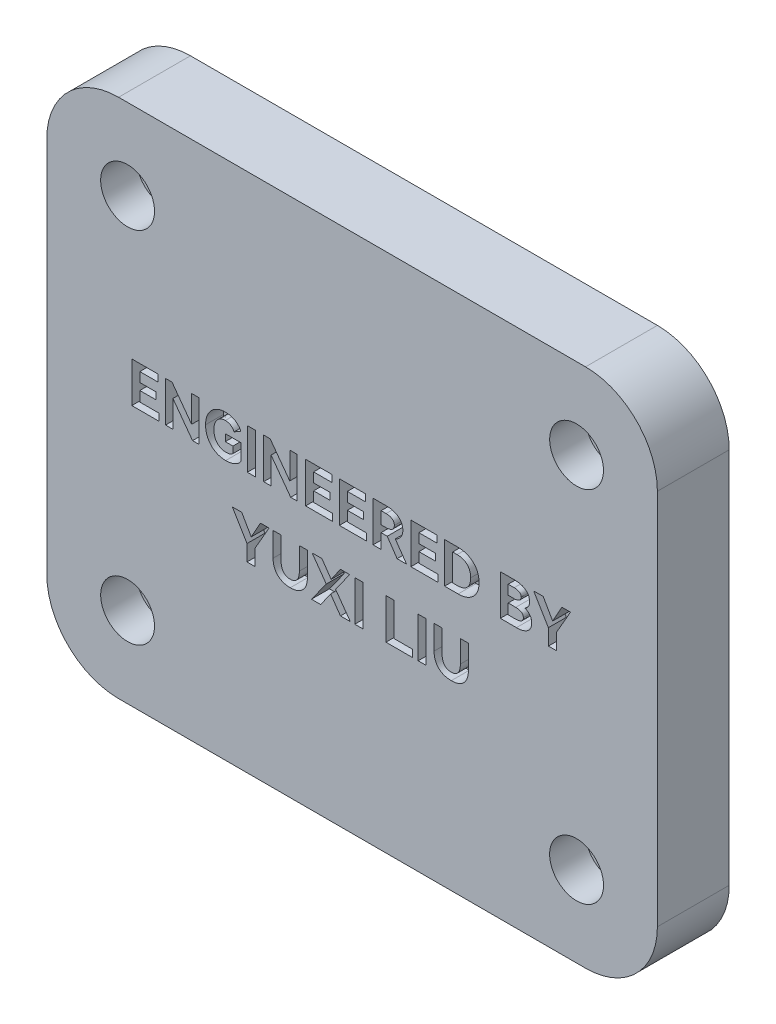
from build123d import *

# Parameters (mm, degrees)
SKETCH1_W           = 68
SKETCH1_H           = 58
BOSS_EXTRUDE1_DEPTH = 8
SKETCH2_R           = 1.6
CUT_EXTRUDE1_DEPTH  = 90.732937097
SKETCH3_R           = 3
CUT_EXTRUDE2_DEPTH  = 4
FILLET1_R           = 8
SKETCH4_W           = 0.89110672
SKETCH4_H           = 4.5
SKETCH4_W_2         = 0.891106719
CUT_EXTRUDE3_DEPTH  = 2


with BuildPart() as part:
    # Sketch1 → Boss-Extrude1 (new body)
    with BuildSketch(Plane.XY):
        with Locations((34, 29)):
            Rectangle(SKETCH1_W, SKETCH1_H)
    extrude(amount=BOSS_EXTRUDE1_DEPTH)

    # Sketch2 → Cut-Extrude1 (cut, through all)
    with BuildSketch(Plane.XY.offset(8)):
        with Locations((9, 49)):
            Circle(SKETCH2_R)
        with Locations((59, 49)):
            Circle(SKETCH2_R)
        with Locations((59, 9)):
            Circle(SKETCH2_R)
        with Locations((9, 9)):
            Circle(SKETCH2_R)
    extrude(amount=-CUT_EXTRUDE1_DEPTH, mode=Mode.SUBTRACT)

    # Sketch3 → Cut-Extrude2 (cut)
    with BuildSketch(Plane.XY.offset(8)):
        with Locations((9, 49)):
            Circle(SKETCH3_R)
        with Locations((59, 49)):
            Circle(SKETCH3_R)
        with Locations((59, 9)):
            Circle(SKETCH3_R)
        with Locations((9, 9)):
            Circle(SKETCH3_R)
    extrude(amount=-CUT_EXTRUDE2_DEPTH, mode=Mode.SUBTRACT)

    # Fillet1
    fillet1_edges = [part.edges().sort_by_distance(p)[0] for p in [
        (0, 0, 4),
        (68, 0, 4),
        (68, 58, 4),
        (0, 58, 4),
    ]]
    fillet(fillet1_edges, radius=FILLET1_R)

    # Sketch4 → Cut-Extrude3 (cut)
    # profile 1 of 19: a face of its own
    with BuildSketch(Plane.XY.offset(8)):
        Polygon((12.190019763, 30.899604743), (10.364229249, 30.899604743), (10.364229249, 29.78083004), (12.472826087, 29.78083004), (12.472826087, 29), (9.47312253, 29), (9.47312253, 33.5), (12.405237154, 33.5), (12.405237154, 32.725395257), (10.364229249, 32.725395257), (10.364229249, 31.66798419), (12.190019763, 31.66798419), align=None)
    # profile 2 of 19: a face of its own
    with BuildSketch(Plane.XY.offset(8)):
        Polygon((13.949110672, 33.5), (16.131521739, 30.5243083), (16.131521739, 33.5), (16.961264822, 33.5), (16.961264822, 29), (16.235573123, 29), (14.047826087, 31.981027668), (14.047826087, 29), (13.229644269, 29), (13.229644269, 33.5), align=None)
    # profile 3 of 19: a face of its own
    with BuildSketch(Plane.XY.offset(8)):
        with BuildLine():
            Line((19.88270751, 30.727075099), (19.88270751, 31.495454545))
            Line((19.88270751, 31.495454545), (21.603557312, 31.495454545))
            Line((21.603557312, 31.495454545), (21.603557312, 29.663438735))
            add(Edge.make_bspline(
                [(21.603557312, 29.663438735), (21.585447013, 29.635459828), (21.549129791, 29.579352739), (21.483778407, 29.501847101), (21.411893283, 29.428092613), (21.332367461, 29.358267831), (21.244525097, 29.293515303), (21.14966514, 29.231717851), (21.04577871, 29.176459685), (20.936457937, 29.123641364), (20.82075793, 29.078241641), (20.702085581, 29.036753427), (20.579431167, 29.003536577), (20.454429545, 28.974424008), (20.325956051, 28.953875328), (20.195233451, 28.93716636), (20.061277186, 28.92868716), (19.971056671, 28.927026331), (19.925395257, 28.926185771)],
                knots=[0, 0, 0, 0, 0.837760271, 1.679990217, 2.544929539, 3.427533874, 4.338910806, 5.288456801, 6.272945858, 7.297089327, 8.341320962, 9.397943387, 10.45827055, 11.53659533, 12.625366476, 13.72988631, 14.851075027, 16, 16, 16, 16], degree=3))
            add(Edge.make_bspline(
                [(19.925395257, 28.926185771), (19.871409128, 28.926938661), (19.764725815, 28.928426467), (19.607045736, 28.943308769), (19.453811488, 28.966301087), (19.305057423, 28.997880887), (19.161195377, 29.040336188), (19.021700147, 29.090670993), (18.886659717, 29.150475949), (18.757238472, 29.219742062), (18.633660795, 29.297431544), (18.515757924, 29.381345642), (18.406339853, 29.474800779), (18.303104708, 29.573882698), (18.207380985, 29.680793635), (18.117984879, 29.794316297), (18.03776203, 29.916844827), (17.962681677, 30.044628298), (17.895738896, 30.178677193), (17.83950323, 30.318868234), (17.789638289, 30.463067224), (17.751500793, 30.612632974), (17.719587191, 30.766527349), (17.697892321, 30.925492423), (17.684083877, 31.089378631), (17.682448163, 31.200169384), (17.681620553, 31.256225296)],
                knots=[0, 0, 0, 0, 1.069561296, 2.113586308, 3.135478133, 4.139054237, 5.124324395, 6.105523171, 7.075971085, 8.048372863, 9.011682409, 9.96706009, 10.913291369, 11.860525061, 12.800627657, 13.754830667, 14.721001889, 15.700334832, 16.690775213, 17.686757511, 18.691776819, 19.711978727, 20.743098853, 21.804839495, 22.889332181, 24, 24, 24, 24], degree=3))
            add(Edge.make_bspline(
                [(17.681620553, 31.256225296), (17.682338975, 31.312882599), (17.683755609, 31.424603387), (17.699035365, 31.589284548), (17.720455292, 31.749232262), (17.752842427, 31.903885675), (17.793450865, 32.054112689), (17.8446463, 32.198732073), (17.902836931, 32.339200919), (17.971957173, 32.473275494), (18.047737827, 32.60194538), (18.131602606, 32.722934999), (18.221747917, 32.83657806), (18.318951419, 32.942646704), (18.422918612, 33.041359504), (18.53383921, 33.132497567), (18.651142017, 33.216118138), (18.774939167, 33.291566893), (18.903742404, 33.359283907), (19.037031444, 33.417688096), (19.173607483, 33.467735011), (19.31340981, 33.509044483), (19.457164658, 33.539563432), (19.603705448, 33.563163425), (19.754094276, 33.57660903), (19.855409131, 33.578295896), (19.906719368, 33.579150198)],
                knots=[0, 0, 0, 0, 1.131159616, 2.230498763, 3.300513467, 4.352457935, 5.383673727, 6.405979992, 7.414253141, 8.417735126, 9.415806143, 10.394568984, 11.355223429, 12.310609564, 13.265408537, 14.21597661, 15.175353225, 16.139940019, 17.109148635, 18.079351229, 19.043919855, 20.012477316, 20.987904129, 21.976802477, 22.975365016, 24, 24, 24, 24], degree=3))
            add(Edge.make_bspline(
                [(19.906719368, 33.579150198), (19.957741945, 33.578353381), (20.058186994, 33.576784736), (20.206014044, 33.56269204), (20.349116485, 33.542108163), (20.486521983, 33.51059684), (20.619186239, 33.471550943), (20.74663359, 33.423253317), (20.869459761, 33.366830499), (20.985491776, 33.300373735), (21.095462155, 33.229405951), (21.196029117, 33.151779924), (21.287574526, 33.06966007), (21.369329282, 32.982214095), (21.443108414, 32.890611067), (21.505887802, 32.793010224), (21.561401855, 32.691536584), (21.589480018, 32.619905248), (21.603557312, 32.583992095)],
                knots=[0, 0, 0, 0, 1.17016001, 2.303622935, 3.403856837, 4.484454622, 5.534447873, 6.5739282, 7.608391433, 8.631549699, 9.638764269, 10.608576157, 11.542682489, 12.456771363, 13.352074797, 14.236699835, 15.115950192, 16, 16, 16, 16], degree=3))
            Line((21.603557312, 32.583992095), (20.866304348, 32.159782609))
            add(Edge.make_bspline(
                [(20.866304348, 32.159782609), (20.842751165, 32.205375626), (20.796433867, 32.295034225), (20.70430848, 32.414031084), (20.59980661, 32.519548247), (20.480179247, 32.608417335), (20.34792225, 32.680633245), (20.202752338, 32.730888687), (20.046600568, 32.763410013), (19.93831196, 32.766497585), (19.88270751, 32.768083004)],
                knots=[0, 0, 0, 0, 1.004386668, 1.97512485, 2.936911434, 3.908797535, 4.886714011, 5.879478124, 6.91114628, 8, 8, 8, 8], degree=3))
            add(Edge.make_bspline(
                [(19.88270751, 32.768083004), (19.82353494, 32.765969904), (19.707391906, 32.761822343), (19.538117607, 32.72580976), (19.378094463, 32.667702216), (19.228365362, 32.586329145), (19.090822965, 32.483953111), (18.968540785, 32.360016776), (18.861419855, 32.216746268), (18.77083859, 32.054408901), (18.698831788, 31.875119675), (18.647768576, 31.680944394), (18.615912822, 31.473082126), (18.612059983, 31.329861795), (18.610079051, 31.256225296)],
                knots=[0, 0, 0, 0, 0.961041044, 1.886316962, 2.799516737, 3.720263746, 4.646492936, 5.576775119, 6.540591128, 7.546013389, 8.590342615, 9.672792099, 10.803469879, 12, 12, 12, 12], degree=3))
            add(Edge.make_bspline(
                [(18.610079051, 31.256225296), (18.610572534, 31.217969109), (18.611545305, 31.142557056), (18.619810833, 31.031256469), (18.632806593, 30.923738881), (18.6519616, 30.820287498), (18.674386898, 30.720186329), (18.704260011, 30.624568211), (18.737628755, 30.532073415), (18.777997727, 30.444496325), (18.82209492, 30.360779922), (18.871405886, 30.282203188), (18.924582366, 30.208287375), (18.982466557, 30.13949658), (19.04521297, 30.076553016), (19.110919789, 30.016989469), (19.18259776, 29.963952998), (19.257935712, 29.915047998), (19.337111424, 29.871258564), (19.419873723, 29.834019936), (19.505860488, 29.802778081), (19.594747428, 29.777208556), (19.68670906, 29.75629344), (19.781899753, 29.742672087), (19.88014108, 29.733112154), (19.94671496, 29.732319602), (19.980533597, 29.731916996)],
                knots=[0, 0, 0, 0, 1.190036652, 2.345845502, 3.470321741, 4.557532515, 5.617930628, 6.659430926, 7.671944366, 8.674877908, 9.656813806, 10.613877645, 11.558417442, 12.487751382, 13.407286364, 14.321766241, 15.244025914, 16.177742668, 17.114733078, 18.055844735, 18.998220842, 19.958478747, 20.931801387, 21.929590883, 22.948259987, 24, 24, 24, 24], degree=3))
            add(Edge.make_bspline(
                [(19.980533597, 29.731916996), (20.019402652, 29.732790956), (20.095270605, 29.734496826), (20.205904828, 29.747189297), (20.310095806, 29.767344326), (20.40796079, 29.795711916), (20.498879894, 29.833070159), (20.583053032, 29.878926817), (20.661599178, 29.932094373), (20.707905717, 29.974688356), (20.731126482, 29.996047431)],
                knots=[0, 0, 0, 0, 1.142493035, 2.230015796, 3.269182953, 4.259205674, 5.220542896, 6.152556429, 7.073585425, 8, 8, 8, 8], degree=3))
            Line((20.731126482, 29.996047431), (20.731126482, 30.727075099))
            Line((20.731126482, 30.727075099), (19.88270751, 30.727075099))
        make_face()
    # profile 4 of 19: a face of its own
    with BuildSketch(Plane.XY.offset(8)):
        with Locations((22.781916996, 31.25)):
            Rectangle(SKETCH4_W, SKETCH4_H)
    # profile 5 of 19: a face of its own
    with BuildSketch(Plane.XY.offset(8)):
        Polygon((24.877173913, 33.5), (27.05958498, 30.5243083), (27.05958498, 33.5), (27.889328063, 33.5), (27.889328063, 29), (27.163636364, 29), (24.975889328, 31.981027668), (24.975889328, 29), (24.15770751, 29), (24.15770751, 33.5), align=None)
    # profile 6 of 19: a face of its own
    with BuildSketch(Plane.XY.offset(8)):
        Polygon((31.541798419, 30.899604743), (29.716007905, 30.899604743), (29.716007905, 29.78083004), (31.824604743, 29.78083004), (31.824604743, 29), (28.824901186, 29), (28.824901186, 33.5), (31.75701581, 33.5), (31.75701581, 32.725395257), (29.716007905, 32.725395257), (29.716007905, 31.66798419), (31.541798419, 31.66798419), align=None)
    # profile 7 of 19: a face of its own
    with BuildSketch(Plane.XY.offset(8)):
        Polygon((35.298320158, 30.899604743), (33.472529644, 30.899604743), (33.472529644, 29.78083004), (35.581126482, 29.78083004), (35.581126482, 29), (32.581422925, 29), (32.581422925, 33.5), (35.513537549, 33.5), (35.513537549, 32.725395257), (33.472529644, 32.725395257), (33.472529644, 31.66798419), (35.298320158, 31.66798419), align=None)
    # profile 8 of 19: a face of its own
    with BuildSketch(Plane.XY.offset(8)):
        with BuildLine():
            Line((40.075790514, 29), (39.01215415, 29.006225296))
            Line((39.01215415, 29.006225296), (37.918280632, 30.623023715))
            Line((37.918280632, 30.623023715), (37.880928854, 30.623023715))
            Line((37.880928854, 30.623023715), (37.229051383, 30.623023715))
            Line((37.229051383, 30.623023715), (37.229051383, 29))
            Line((37.229051383, 29), (36.337944664, 29))
            Line((36.337944664, 29), (36.337944664, 33.5))
            Line((36.337944664, 33.5), (37.893379447, 33.5))
            add(Edge.make_bspline(
                [(37.893379447, 33.5), (37.936679816, 33.499606859), (38.022189633, 33.498830482), (38.148223538, 33.489103588), (38.270605298, 33.476411814), (38.388844446, 33.456982396), (38.502579159, 33.430682165), (38.612748583, 33.400952622), (38.718540022, 33.364053528), (38.820654082, 33.322794195), (38.917544489, 33.275375392), (39.009289511, 33.224136509), (39.094941597, 33.167666163), (39.175456042, 33.107464879), (39.249551041, 33.041139713), (39.31768814, 32.970193591), (39.380687969, 32.894914748), (39.437214416, 32.815064858), (39.488192475, 32.731495571), (39.5318286, 32.644278992), (39.567841286, 32.553813054), (39.599877896, 32.461632198), (39.622436751, 32.365559348), (39.639601857, 32.267013963), (39.649360955, 32.165017603), (39.650833536, 32.096066959), (39.651581028, 32.061067194)],
                knots=[0, 0, 0, 0, 1.2200695, 2.409400225, 3.560858665, 4.687156797, 5.783684645, 6.849872993, 7.90145962, 8.939416468, 9.952046838, 10.939655477, 11.899012187, 12.841448216, 13.770493987, 14.69818634, 15.611737774, 16.534412784, 17.452879405, 18.368300956, 19.279020852, 20.195813937, 21.115799313, 22.056678637, 23.013558267, 24, 24, 24, 24], degree=3))
            add(Edge.make_bspline(
                [(39.651581028, 32.061067194), (39.65092733, 32.025760747), (39.649633377, 31.955873799), (39.638478491, 31.853110903), (39.621840227, 31.753469143), (39.597677141, 31.657149432), (39.566658974, 31.563717426), (39.528331327, 31.473570348), (39.482732353, 31.387251201), (39.430971496, 31.304370934), (39.373565843, 31.225129524), (39.308996587, 31.151336334), (39.239497974, 31.081783069), (39.164828487, 31.016713468), (39.084173188, 30.956779037), (38.99775389, 30.901963695), (38.906318748, 30.850729656), (38.84193412, 30.821759294), (38.809387352, 30.807114625)],
                knots=[0, 0, 0, 0, 1.054662233, 2.087639297, 3.085144338, 4.071218206, 5.051586526, 6.023918905, 6.994636113, 7.965474552, 8.941672438, 9.914932327, 10.892013905, 11.877769453, 12.871610298, 13.891324161, 14.934053283, 16, 16, 16, 16], degree=3))
            Line((38.809387352, 30.807114625), (40.075790514, 29))
        make_face()
        with BuildLine():
            Line((37.229051383, 32.743181818), (37.229051383, 31.378952569))
            Line((37.229051383, 31.378952569), (37.788438735, 31.378952569))
            add(Edge.make_bspline(
                [(37.788438735, 31.378952569), (37.820471735, 31.379448719), (37.883454677, 31.380424243), (37.975831558, 31.38856891), (38.064386311, 31.401784315), (38.148381445, 31.420521454), (38.228659971, 31.443329035), (38.303863977, 31.47305816), (38.375903199, 31.506754044), (38.443100893, 31.546411806), (38.50428215, 31.591565494), (38.558908306, 31.641318134), (38.603260091, 31.698489924), (38.641327413, 31.759785685), (38.6697824, 31.827704016), (38.690241884, 31.900559244), (38.701645259, 31.979191825), (38.703491999, 32.033166104), (38.70444664, 32.061067194)],
                knots=[0, 0, 0, 0, 1.193392064, 2.34643473, 3.452436324, 4.527106391, 5.551260628, 6.558417018, 7.536691432, 8.512280761, 9.460022067, 10.366574529, 11.254978474, 12.147219442, 13.047898509, 13.988597637, 14.960239605, 16, 16, 16, 16], degree=3))
            add(Edge.make_bspline(
                [(38.70444664, 32.061067194), (38.703456022, 32.089256557), (38.701528799, 32.144098255), (38.690564314, 32.223723151), (38.669376188, 32.297119875), (38.642492053, 32.365630905), (38.605126099, 32.427469757), (38.560631857, 32.484014282), (38.507287555, 32.534188856), (38.446613864, 32.578386105), (38.379925703, 32.617202837), (38.308514443, 32.651078974), (38.23265121, 32.679631423), (38.152208078, 32.702340284), (38.067747483, 32.721637801), (37.978402463, 32.733217295), (37.884950046, 32.741829667), (37.821069379, 32.742724654), (37.788438735, 32.743181818)],
                knots=[0, 0, 0, 0, 1.047934578, 2.038730344, 2.976872647, 3.881028202, 4.765166578, 5.651155837, 6.547222764, 7.476984859, 8.434839262, 9.410454722, 10.41093961, 11.4428885, 12.51463761, 13.626944928, 14.787828634, 16, 16, 16, 16], degree=3))
            Line((37.788438735, 32.743181818), (37.229051383, 32.743181818))
        make_face(mode=Mode.SUBTRACT)
    # profile 9 of 19: a face of its own
    with BuildSketch(Plane.XY.offset(8)):
        Polygon((43.266699605, 30.899604743), (41.440909091, 30.899604743), (41.440909091, 29.78083004), (43.549505929, 29.78083004), (43.549505929, 29), (40.549802372, 29), (40.549802372, 33.5), (43.481916996, 33.5), (43.481916996, 32.725395257), (41.440909091, 32.725395257), (41.440909091, 31.66798419), (43.266699605, 31.66798419), align=None)
    # profile 10 of 19: a face of its own
    with BuildSketch(Plane.XY.offset(8)):
        with BuildLine():
            add(Edge.make_bspline(
                [(45.806620553, 33.5), (45.860893251, 33.499100468), (45.96809906, 33.497323608), (46.126632921, 33.484576792), (46.281277371, 33.464039749), (46.432260393, 33.435960293), (46.579373829, 33.398700329), (46.721799539, 33.351740501), (46.8612025, 33.29882251), (46.995959883, 33.236487667), (47.125465595, 33.166848738), (47.247827345, 33.088751083), (47.363929083, 33.004465251), (47.472721689, 32.911664394), (47.574064805, 32.810907206), (47.668893169, 32.702994195), (47.755883775, 32.587091182), (47.836096765, 32.464272003), (47.908335844, 32.334673006), (47.970235608, 32.198163622), (48.024020375, 32.056355081), (48.067969231, 31.908133062), (48.100137771, 31.753295405), (48.123993555, 31.592960711), (48.140065557, 31.426709117), (48.141344392, 31.313773753), (48.141996047, 31.256225296)],
                knots=[0, 0, 0, 0, 1.071711807, 2.116971104, 3.138652708, 4.151338474, 5.148077585, 6.132969995, 7.111438821, 8.091097786, 9.062906638, 10.012978114, 10.955571233, 11.894065112, 12.833745052, 13.775465164, 14.728525936, 15.69302499, 16.670460021, 17.655439419, 18.650320097, 19.6635641, 20.704963763, 21.770502017, 22.863915051, 24, 24, 24, 24], degree=3))
            add(Edge.make_bspline(
                [(48.141996047, 31.256225296), (48.141334489, 31.198677443), (48.140032827, 31.085447948), (48.124036295, 30.918895329), (48.100257585, 30.758536558), (48.067740684, 30.603776154), (48.023819452, 30.455003553), (47.970670579, 30.312040924), (47.908069632, 30.174951138), (47.836142842, 30.044617006), (47.755868771, 29.920945516), (47.668952019, 29.804091082), (47.574046414, 29.695663902), (47.473668421, 29.593342292), (47.36485799, 29.500360014), (47.249582492, 29.414467486), (47.127361003, 29.336194754), (46.998937976, 29.265024408), (46.864511703, 29.203303456), (46.726000824, 29.148535975), (46.5831459, 29.102383249), (46.435724, 29.065174378), (46.284660146, 29.035584197), (46.128989052, 29.015463357), (45.969285126, 29.002686087), (45.861190355, 29.000901113), (45.806620553, 29)],
                knots=[0, 0, 0, 0, 1.133225957, 2.229702705, 3.292559499, 4.325627437, 5.341923461, 6.345235728, 7.327736395, 8.307822006, 9.2747903, 10.230122054, 11.173872514, 12.111187721, 13.051118595, 13.990105764, 14.940929524, 15.907968343, 16.879861028, 17.852542807, 18.840511852, 19.834742639, 20.845976449, 21.870875749, 22.925147923, 24, 24, 24, 24], degree=3))
            Line((45.806620553, 29), (44.306324111, 29))
            Line((44.306324111, 29), (44.306324111, 33.5))
            Line((44.306324111, 33.5), (45.806620553, 33.5))
        make_face()
        with BuildLine():
            add(Edge.make_bspline(
                [(45.701679842, 29.76215415), (45.760420111, 29.763362485), (45.874624063, 29.765711754), (46.040652842, 29.783495305), (46.196364301, 29.813523295), (46.341444644, 29.856005423), (46.476302954, 29.910488885), (46.600245529, 29.977075627), (46.713563238, 30.056259535), (46.816252272, 30.147002167), (46.906916809, 30.249930313), (46.986909915, 30.362550351), (47.053844891, 30.486247217), (47.107928476, 30.620673914), (47.150643454, 30.765074253), (47.180628524, 30.919917969), (47.198389562, 31.084761436), (47.20075994, 31.198077756), (47.201976285, 31.256225296)],
                knots=[0, 0, 0, 0, 1.167953641, 2.270757765, 3.315899487, 4.317593627, 5.272176862, 6.203262519, 7.109264452, 8.015438977, 8.921613502, 9.831003729, 10.756905575, 11.711488811, 12.707529366, 13.74688605, 14.843829069, 16, 16, 16, 16], degree=3))
            add(Edge.make_bspline(
                [(47.201976285, 31.256225296), (47.200735568, 31.31347902), (47.19831858, 31.425012623), (47.180873874, 31.58761985), (47.149485706, 31.740170436), (47.107105163, 31.882920051), (47.052715334, 32.016220849), (46.984963533, 32.138949538), (46.905260796, 32.252207949), (46.813223425, 32.354745729), (46.710101902, 32.446520483), (46.596076973, 32.525881041), (46.472851067, 32.594394935), (46.338083342, 32.64822063), (46.193350345, 32.690836407), (46.038381124, 32.722044788), (45.873130989, 32.739527856), (45.759823071, 32.741942671), (45.701679842, 32.743181818)],
                knots=[0, 0, 0, 0, 1.143434422, 2.227477164, 3.260895609, 4.249907975, 5.197672452, 6.130431302, 7.043765239, 7.957808935, 8.876271422, 9.79444762, 10.72720647, 11.685929401, 12.686289439, 13.737115077, 14.838815157, 16, 16, 16, 16], degree=3))
            Line((45.701679842, 32.743181818), (45.19743083, 32.743181818))
            Line((45.19743083, 32.743181818), (45.19743083, 29.76215415))
            Line((45.19743083, 29.76215415), (45.701679842, 29.76215415))
        make_face(mode=Mode.SUBTRACT)
    # profile 11 of 19: a face of its own
    with BuildSketch(Plane.XY.offset(8)):
        with BuildLine():
            add(Edge.make_bspline(
                [(53.258300395, 31.336264822), (53.288399813, 31.325098941), (53.347605217, 31.30313571), (53.43209886, 31.264024956), (53.510547507, 31.220111123), (53.583553647, 31.173195685), (53.65086755, 31.122501917), (53.711329619, 31.066886533), (53.766953273, 31.008012533), (53.817025839, 30.944859945), (53.860221694, 30.877243284), (53.898398597, 30.806030149), (53.929679335, 30.730735092), (53.957191634, 30.65169336), (53.977148891, 30.568524886), (53.991230642, 30.481405273), (54.000582482, 30.390520284), (54.001374197, 30.328383706), (54.001778656, 30.296640316)],
                knots=[0, 0, 0, 0, 1.118818822, 2.200711033, 3.241553326, 4.250512751, 5.223973887, 6.174905597, 7.110668516, 8.045118163, 8.979567809, 9.904137332, 10.858040273, 11.818803306, 12.818832771, 13.834753529, 14.893851807, 16, 16, 16, 16], degree=3))
            add(Edge.make_bspline(
                [(54.001778656, 30.296640316), (54.000397586, 30.247360541), (53.997697913, 30.151029913), (53.977023036, 30.010501281), (53.94239391, 29.877966501), (53.893516687, 29.753509044), (53.829526907, 29.637987619), (53.752553732, 29.530251875), (53.661274432, 29.431306882), (53.556384754, 29.341172977), (53.43936453, 29.260388024), (53.309842963, 29.191056646), (53.170189522, 29.131113273), (53.018592108, 29.083718022), (52.856469041, 29.045004524), (52.6826876, 29.019230724), (52.49794741, 29.002795035), (52.37108489, 29.000949365), (52.30583004, 29)],
                knots=[0, 0, 0, 0, 0.980494461, 1.916641186, 2.81961074, 3.70153889, 4.570265206, 5.44127233, 6.330648019, 7.24253577, 8.188428989, 9.154619336, 10.161697494, 11.208416174, 12.311731756, 13.475717384, 14.701573284, 16, 16, 16, 16], degree=3))
            Line((52.30583004, 29), (50.51027668, 29))
            Line((50.51027668, 29), (50.51027668, 33.5))
            Line((50.51027668, 33.5), (52.139525692, 33.5))
            add(Edge.make_bspline(
                [(52.139525692, 33.5), (52.198250047, 33.498931025), (52.312934691, 33.49684339), (52.480601938, 33.481877051), (52.639734519, 33.455647801), (52.791252095, 33.421150111), (52.933545336, 33.373204535), (53.068158533, 33.317504001), (53.194090724, 33.250434322), (53.31095859, 33.173552012), (53.417478958, 33.087832107), (53.509422685, 32.991728233), (53.588732067, 32.888518229), (53.652134805, 32.775643838), (53.702624545, 32.655264332), (53.736536012, 32.525876394), (53.758855843, 32.388816598), (53.761296921, 32.294460399), (53.762549407, 32.246047431)],
                knots=[0, 0, 0, 0, 1.221040176, 2.384607852, 3.496273299, 4.57277662, 5.611723703, 6.614569644, 7.599003706, 8.573487563, 9.51982331, 10.435302592, 11.332800376, 12.218922678, 13.119821967, 14.039421554, 14.994052076, 16, 16, 16, 16], degree=3))
            add(Edge.make_bspline(
                [(53.762549407, 32.246047431), (53.761016491, 32.19586178), (53.758042152, 32.098485841), (53.734899532, 31.957242874), (53.694927719, 31.826845481), (53.639040783, 31.706964626), (53.568218897, 31.596804882), (53.4803377, 31.498019348), (53.376761306, 31.409339025), (53.298447096, 31.361029853), (53.258300395, 31.336264822)],
                knots=[0, 0, 0, 0, 1.099553501, 2.133479419, 3.126079771, 4.079461809, 5.023768473, 5.985789349, 6.967442668, 8, 8, 8, 8], degree=3))
        make_face()
        with BuildLine():
            Line((51.383596838, 32.725395257), (51.383596838, 31.661758893))
            Line((51.383596838, 31.661758893), (52.05326087, 31.661758893))
            add(Edge.make_bspline(
                [(52.05326087, 31.661758893), (52.110576367, 31.663648766), (52.220001673, 31.667256863), (52.374997984, 31.693874067), (52.511204984, 31.741374927), (52.61003846, 31.796873001), (52.677732113, 31.849812968), (52.721346418, 31.892409516), (52.758540857, 31.93810428), (52.788059546, 31.987699977), (52.811124673, 32.040336609), (52.828320237, 32.095748577), (52.838160564, 32.154394908), (52.839586425, 32.194430193), (52.840316206, 32.214920949)],
                knots=[0, 0, 0, 0, 1.91479465, 3.655677756, 5.231467064, 6.713138413, 7.418562491, 8.097985844, 8.746148474, 9.381468873, 10.020100863, 10.662409344, 11.315397821, 12, 12, 12, 12], degree=3))
            add(Edge.make_bspline(
                [(52.840316206, 32.214920949), (52.839609676, 32.234827169), (52.838229947, 32.273700582), (52.828137787, 32.330118707), (52.812401669, 32.383271094), (52.788900912, 32.432504916), (52.758988481, 32.478251023), (52.72364713, 32.521467613), (52.680150261, 32.559553554), (52.613218464, 32.606964793), (52.51406512, 32.655569985), (52.377877906, 32.697085777), (52.221922913, 32.721615589), (52.111455725, 32.724091127), (52.05326087, 32.725395257)],
                knots=[0, 0, 0, 0, 0.680418715, 1.328740338, 1.954065901, 2.570786416, 3.186589749, 3.81999806, 4.473293787, 5.156801734, 6.621163746, 8.224356342, 10.010965592, 12, 12, 12, 12], degree=3))
            Line((52.05326087, 32.725395257), (51.383596838, 32.725395257))
        make_face(mode=Mode.SUBTRACT)
        with BuildLine():
            add(Edge.make_bspline(
                [(52.23201581, 29.774604743), (52.264928365, 29.775252147), (52.328736398, 29.776507278), (52.421430766, 29.782301046), (52.508255379, 29.793683363), (52.589138573, 29.811035525), (52.664594795, 29.830787898), (52.73408766, 29.855812537), (52.797333126, 29.886262023), (52.855385079, 29.920702506), (52.906994655, 29.959781305), (52.951969596, 30.002612145), (52.989810524, 30.049602247), (53.021150729, 30.099884416), (53.044340957, 30.155020272), (53.062444572, 30.212939456), (53.072030518, 30.275577334), (53.073469053, 30.318252124), (53.074209486, 30.340217391)],
                knots=[0, 0, 0, 0, 1.382825555, 2.680903359, 3.899677623, 5.05736951, 6.153970811, 7.174309096, 8.154648833, 9.098641606, 10.00525847, 10.868410623, 11.700830498, 12.533809106, 13.348147117, 14.206976277, 15.077107487, 16, 16, 16, 16], degree=3))
            add(Edge.make_bspline(
                [(53.074209486, 30.340217391), (53.073446074, 30.362178709), (53.071952719, 30.405138525), (53.062593861, 30.468119149), (53.044154117, 30.526528134), (53.021179092, 30.582299449), (52.989866376, 30.633517491), (52.951706236, 30.681347624), (52.907400484, 30.726070394), (52.855116871, 30.765779051), (52.797660517, 30.802311226), (52.733893575, 30.833741766), (52.663812876, 30.858958934), (52.588301263, 30.881628234), (52.506138088, 30.898275699), (52.417838419, 30.909438588), (52.323735015, 30.916665403), (52.259005778, 30.917732871), (52.225790514, 30.918280632)],
                knots=[0, 0, 0, 0, 0.912319421, 1.784641302, 2.63363131, 3.449950279, 4.283901569, 5.116397762, 5.986893518, 6.890617376, 7.836698498, 8.811187296, 9.835639131, 10.926367186, 12.082849546, 13.312068463, 14.620710532, 16, 16, 16, 16], degree=3))
            Line((52.225790514, 30.918280632), (51.383596838, 30.918280632))
            Line((51.383596838, 30.918280632), (51.383596838, 29.774604743))
            Line((51.383596838, 29.774604743), (52.23201581, 29.774604743))
        make_face(mode=Mode.SUBTRACT)
    # profile 12 of 19: a face of its own
    with BuildSketch(Plane.XY.offset(8)):
        Polygon((56.33715415, 31.655533597), (57.358102767, 33.5), (58.323023715, 33.5), (56.75513834, 30.770652174), (56.75513834, 29), (55.864031621, 29), (55.864031621, 30.77687747), (54.228557312, 33.5), (55.279743083, 33.5), align=None)
    # profile 13 of 19: a face of its own
    with BuildSketch(Plane.XY.offset(8)):
        Polygon((22.769565217, 22.983992095), (23.790513834, 24.828458498), (24.755434783, 24.828458498), (23.187549407, 22.099110672), (23.187549407, 20.328458498), (22.296442688, 20.328458498), (22.296442688, 22.105335968), (20.660968379, 24.828458498), (21.71215415, 24.828458498), align=None)
    # profile 14 of 19: a face of its own
    with BuildSketch(Plane.XY.offset(8)):
        with BuildLine():
            Line((28.129545455, 24.828458498), (29.020652174, 24.828458498))
            Line((29.020652174, 24.828458498), (29.020652174, 22.148023715))
            add(Edge.make_bspline(
                [(29.020652174, 22.148023715), (29.020000269, 22.100571553), (29.018719201, 22.007322545), (29.007661092, 21.869573501), (28.990171726, 21.736523943), (28.965361979, 21.60818027), (28.933047961, 21.484684296), (28.894257084, 21.365720187), (28.84780143, 21.251342371), (28.794293595, 21.142200912), (28.735427728, 21.037739754), (28.667685078, 20.940944845), (28.596051711, 20.8484879), (28.516493506, 20.76323032), (28.430920437, 20.683843042), (28.338945286, 20.61043368), (28.240151311, 20.544152361), (28.135680555, 20.483374929), (28.025923282, 20.429091369), (27.910245824, 20.383163177), (27.790300633, 20.342461799), (27.664545089, 20.311365623), (27.534452074, 20.284762215), (27.399178666, 20.267684969), (27.259081765, 20.256560754), (27.164054139, 20.255290484), (27.115711462, 20.254644269)],
                knots=[0, 0, 0, 0, 1.123185627, 2.207190164, 3.269163521, 4.298641387, 5.299496827, 6.289268694, 7.258831827, 8.21923409, 9.165403558, 10.093919452, 11.013481476, 11.932159396, 12.850837316, 13.77475387, 14.71486612, 15.664542481, 16.634334162, 17.610402549, 18.609041253, 19.630281915, 20.674885131, 21.750772402, 22.855767676, 24, 24, 24, 24], degree=3))
            add(Edge.make_bspline(
                [(27.115711462, 20.254644269), (27.066776428, 20.255293565), (26.970565598, 20.256570142), (26.828982325, 20.267633239), (26.69252681, 20.284759385), (26.561557796, 20.31139748), (26.435141186, 20.342279969), (26.314742914, 20.383385954), (26.198588907, 20.428860356), (26.08863855, 20.483403005), (25.984155546, 20.544146038), (25.885358271, 20.610431467), (25.793407808, 20.683857744), (25.707740085, 20.763173986), (25.628410676, 20.84883384), (25.555455755, 20.940315157), (25.48923796, 21.038344369), (25.428848381, 21.141865581), (25.375781379, 21.251420352), (25.328882596, 21.365526602), (25.291540871, 21.484873382), (25.258861968, 21.608152362), (25.234160224, 21.736531768), (25.216640679, 21.869571341), (25.205590815, 22.007323113), (25.20430861, 22.100571745), (25.203656126, 22.148023715)],
                knots=[0, 0, 0, 0, 1.155523229, 2.271866189, 3.352149668, 4.401149285, 5.42675874, 6.423034746, 7.403290734, 8.370787966, 9.31821747, 10.25610549, 11.177836133, 12.094340535, 13.010844938, 13.93257558, 14.854944135, 15.802373639, 16.760503668, 17.727772893, 18.713041353, 19.711528851, 20.738571055, 21.798031869, 22.879471739, 24, 24, 24, 24], degree=3))
            Line((25.203656126, 22.148023715), (25.203656126, 24.828458498))
            Line((25.203656126, 24.828458498), (26.094762846, 24.828458498))
            Line((26.094762846, 24.828458498), (26.094762846, 22.363241107))
            add(Edge.make_bspline(
                [(26.094762846, 22.363241107), (26.095627842, 22.310744537), (26.097306634, 22.208858813), (26.109880877, 22.061240363), (26.129891273, 21.923551267), (26.158793221, 21.796053742), (26.197390277, 21.679376991), (26.242188553, 21.572430393), (26.296911103, 21.47634396), (26.360101482, 21.39083301), (26.430925955, 21.315354681), (26.508756527, 21.250313907), (26.592766669, 21.194243542), (26.684703366, 21.150064616), (26.782518148, 21.114099882), (26.887591898, 21.089260804), (26.999421901, 21.075272488), (27.076245182, 21.073068837), (27.115711462, 21.071936759)],
                knots=[0, 0, 0, 0, 1.344225643, 2.608882906, 3.79093548, 4.905046283, 5.951733108, 6.93458622, 7.869601029, 8.776042514, 9.651434434, 10.513592479, 11.368433444, 12.230791999, 13.119350411, 14.032632583, 14.989308017, 16, 16, 16, 16], degree=3))
            add(Edge.make_bspline(
                [(27.115711462, 21.071936759), (27.154585464, 21.073076486), (27.230522432, 21.075302844), (27.341162338, 21.089287627), (27.44512634, 21.11393034), (27.54165036, 21.150235517), (27.632574889, 21.19450825), (27.716402201, 21.250003135), (27.793402473, 21.315682799), (27.864244806, 21.390787379), (27.927386526, 21.476356779), (27.982122803, 21.572426723), (28.026917129, 21.679378066), (28.065515342, 21.796053426), (28.09441695, 21.923551359), (28.114427446, 22.061240336), (28.12700166, 22.208858821), (28.128680456, 22.31074454), (28.129545455, 22.363241107)],
                knots=[0, 0, 0, 0, 0.99908038, 1.951616292, 2.860752761, 3.738180462, 4.596784729, 5.45467889, 6.31409399, 7.192612506, 8.102291486, 9.040645843, 10.027009366, 11.077434593, 12.195524613, 13.381799069, 14.650973249, 16, 16, 16, 16], degree=3))
            Line((28.129545455, 22.363241107), (28.129545455, 24.828458498))
        make_face()
    # profile 15 of 19: a face of its own
    with BuildSketch(Plane.XY.offset(8)):
        Polygon((33.737648221, 24.828458498), (32.157312253, 22.633596838), (33.811462451, 20.328458498), (32.704249012, 20.328458498), (31.610375494, 21.907905138), (30.51027668, 20.328458498), (29.477766798, 20.328458498), (31.124802372, 22.614920949), (29.551581028, 24.828458498), (30.639229249, 24.828458498), (31.67173913, 23.340612648), (32.704249012, 24.828458498), align=None)
    # profile 16 of 19: a face of its own
    with BuildSketch(Plane.XY.offset(8)):
        with Locations((34.747924901, 22.578458498)):
            Rectangle(SKETCH4_W_2, SKETCH4_H)
    # profile 17 of 19: a face of its own
    with BuildSketch(Plane.XY.offset(8)):
        Polygon((37.7743083, 24.828458498), (38.66541502, 24.828458498), (38.66541502, 21.127964427), (40.712648221, 21.127964427), (40.712648221, 20.328458498), (37.7743083, 20.328458498), align=None)
    # profile 18 of 19: a face of its own
    with BuildSketch(Plane.XY.offset(8)):
        with Locations((41.805632411, 22.578458498)):
            Rectangle(SKETCH4_W, SKETCH4_H)
    # profile 19 of 19: a face of its own
    with BuildSketch(Plane.XY.offset(8)):
        with BuildLine():
            Line((46.058399209, 24.828458498), (46.949505929, 24.828458498))
            Line((46.949505929, 24.828458498), (46.949505929, 22.148023715))
            add(Edge.make_bspline(
                [(46.949505929, 22.148023715), (46.948854024, 22.100571553), (46.947572956, 22.007322545), (46.936514847, 21.869573501), (46.919025481, 21.736523943), (46.894215734, 21.60818027), (46.861901716, 21.484684296), (46.823110839, 21.365720187), (46.776655185, 21.251342371), (46.72314735, 21.142200912), (46.664281483, 21.037739754), (46.596538833, 20.940944845), (46.524905466, 20.8484879), (46.44534726, 20.76323032), (46.359774192, 20.683843042), (46.267799041, 20.61043368), (46.169005066, 20.544152361), (46.06453431, 20.483374929), (45.954777036, 20.429091369), (45.839099579, 20.383163177), (45.719154388, 20.342461799), (45.593398844, 20.311365623), (45.463305829, 20.284762215), (45.328032421, 20.267684969), (45.18793552, 20.256560754), (45.092907894, 20.255290484), (45.044565217, 20.254644269)],
                knots=[0, 0, 0, 0, 1.123185627, 2.207190164, 3.269163521, 4.298641387, 5.299496827, 6.289268694, 7.258831827, 8.21923409, 9.165403558, 10.093919452, 11.013481476, 11.932159396, 12.850837316, 13.77475387, 14.71486612, 15.664542481, 16.634334162, 17.610402549, 18.609041253, 19.630281915, 20.674885131, 21.750772402, 22.855767676, 24, 24, 24, 24], degree=3))
            add(Edge.make_bspline(
                [(45.044565217, 20.254644269), (44.995630183, 20.255293565), (44.899419353, 20.256570142), (44.75783608, 20.267633239), (44.621380565, 20.284759385), (44.49041155, 20.31139748), (44.363994941, 20.342279969), (44.243596669, 20.383385954), (44.127442662, 20.428860356), (44.017492305, 20.483403005), (43.913009301, 20.544146038), (43.814212026, 20.610431467), (43.722261563, 20.683857744), (43.63659384, 20.763173986), (43.557264431, 20.84883384), (43.484309509, 20.940315157), (43.418091715, 21.038344369), (43.357702136, 21.141865581), (43.304635134, 21.251420352), (43.257736351, 21.365526602), (43.220394626, 21.484873382), (43.187715723, 21.608152362), (43.163013979, 21.736531768), (43.145494434, 21.869571341), (43.13444457, 22.007323113), (43.133162365, 22.100571745), (43.132509881, 22.148023715)],
                knots=[0, 0, 0, 0, 1.155523229, 2.271866189, 3.352149668, 4.401149285, 5.42675874, 6.423034746, 7.403290734, 8.370787966, 9.31821747, 10.25610549, 11.177836133, 12.094340535, 13.010844938, 13.93257558, 14.854944135, 15.802373639, 16.760503668, 17.727772893, 18.713041353, 19.711528851, 20.738571055, 21.798031869, 22.879471739, 24, 24, 24, 24], degree=3))
            Line((43.132509881, 22.148023715), (43.132509881, 24.828458498))
            Line((43.132509881, 24.828458498), (44.023616601, 24.828458498))
            Line((44.023616601, 24.828458498), (44.023616601, 22.363241107))
            add(Edge.make_bspline(
                [(44.023616601, 22.363241107), (44.024481597, 22.310744537), (44.026160389, 22.208858813), (44.038734632, 22.061240363), (44.058745028, 21.923551267), (44.087646976, 21.796053742), (44.126244032, 21.679376991), (44.171042308, 21.572430393), (44.225764858, 21.47634396), (44.288955237, 21.39083301), (44.35977971, 21.315354681), (44.437610282, 21.250313907), (44.521620424, 21.194243542), (44.613557121, 21.150064616), (44.711371903, 21.114099882), (44.816445653, 21.089260804), (44.928275656, 21.075272488), (45.005098937, 21.073068837), (45.044565217, 21.071936759)],
                knots=[0, 0, 0, 0, 1.344225643, 2.608882906, 3.79093548, 4.905046283, 5.951733108, 6.93458622, 7.869601029, 8.776042514, 9.651434434, 10.513592479, 11.368433444, 12.230791999, 13.119350411, 14.032632583, 14.989308017, 16, 16, 16, 16], degree=3))
            add(Edge.make_bspline(
                [(45.044565217, 21.071936759), (45.083439219, 21.073076486), (45.159376187, 21.075302844), (45.270016093, 21.089287627), (45.373980095, 21.11393034), (45.470504115, 21.150235517), (45.561428644, 21.19450825), (45.645255956, 21.250003135), (45.722256228, 21.315682799), (45.793098561, 21.390787379), (45.856240281, 21.476356779), (45.910976558, 21.572426723), (45.955770884, 21.679378066), (45.994369097, 21.796053426), (46.023270705, 21.923551359), (46.043281201, 22.061240336), (46.055855415, 22.208858821), (46.057534211, 22.31074454), (46.058399209, 22.363241107)],
                knots=[0, 0, 0, 0, 0.99908038, 1.951616292, 2.860752761, 3.738180462, 4.596784729, 5.45467889, 6.31409399, 7.192612506, 8.102291486, 9.040645843, 10.027009366, 11.077434593, 12.195524613, 13.381799069, 14.650973249, 16, 16, 16, 16], degree=3))
            Line((46.058399209, 22.363241107), (46.058399209, 24.828458498))
        make_face()
    extrude(amount=-CUT_EXTRUDE3_DEPTH, mode=Mode.SUBTRACT)


solid = part.part
